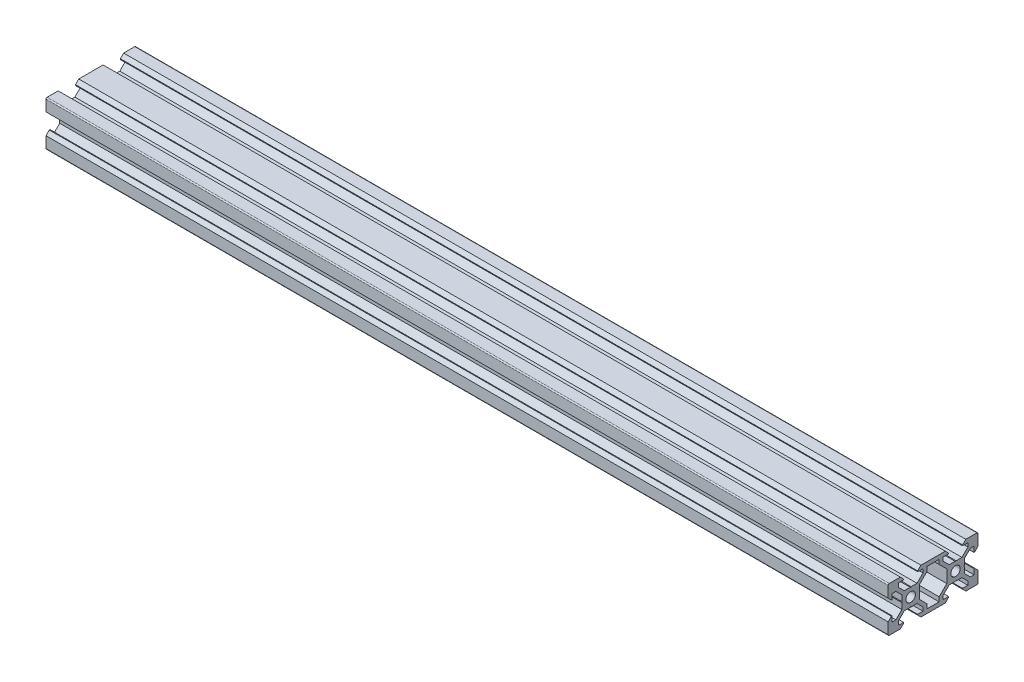
from build123d import *

# Parameters (mm, degrees)
PROFILE_SKETCH_R      = 2.1
PROFILE_EXTRUDE_DEPTH = 375


with BuildPart() as part:
    # Profile Sketch → Profile Extrude (new body)
    with BuildSketch(Plane(origin=(0, 0, 0), x_dir=(0, 0, -1), z_dir=(1, 0, 0))):
        with BuildLine():
            Line((6.875, 8.545), (5.42, 10))
            Line((5.42, 10), (-5.42, 10))
            Line((-5.42, 10), (-6.875, 8.545))
            Line((-6.875, 8.545), (-6.875, 8.2))
            Line((-6.875, 8.2), (-4.5, 8.2))
            Line((-4.5, 8.2), (-4.5, 6.56))
            Line((-4.5, 6.56), (-7.16, 3.9))
            Line((-7.16, 3.9), (-9.79, 3.9))
            Line((-9.79, 3.9), (-10, 3.69))
            Line((-10, 3.69), (-10.21, 3.9))
            Line((-10.21, 3.9), (-12.84, 3.9))
            Line((-12.84, 3.9), (-15.5, 6.56))
            Line((-15.5, 6.56), (-15.5, 8.2))
            Line((-15.5, 8.2), (-13.125, 8.2))
            Line((-13.125, 8.2), (-13.125, 8.545))
            Line((-13.125, 8.545), (-14.58, 10))
            Line((-14.58, 10), (-19.5, 10))
            ThreePointArc((-19.5, 10), (-19.853553391, 9.853553391), (-20, 9.5))
            Line((-20, 9.5), (-20, 4.58))
            Line((-20, 4.58), (-18.545, 3.125))
            Line((-18.545, 3.125), (-18.2, 3.125))
            Line((-18.2, 3.125), (-18.2, 5.5))
            Line((-18.2, 5.5), (-16.56, 5.5))
            Line((-16.56, 5.5), (-13.9, 2.838679656))
            Line((-13.9, 2.838679656), (-13.9, 0.21))
            Line((-13.9, 0.21), (-13.69, 0))
            Line((-13.69, 0), (-13.9, -0.21))
            Line((-13.9, -0.21), (-13.9, -2.838679656))
            Line((-13.9, -2.838679656), (-16.56, -5.5))
            Line((-16.56, -5.5), (-18.2, -5.5))
            Line((-18.2, -5.5), (-18.2, -3.125))
            Line((-18.2, -3.125), (-18.545, -3.125))
            Line((-18.545, -3.125), (-20, -4.58))
            Line((-20, -4.58), (-20, -9.5))
            ThreePointArc((-20, -9.5), (-19.853553391, -9.853553391), (-19.5, -10))
            Line((-19.5, -10), (-14.58, -10))
            Line((-14.58, -10), (-13.125, -8.545))
            Line((-13.125, -8.545), (-13.125, -8.2))
            Line((-13.125, -8.2), (-15.5, -8.2))
            Line((-15.5, -8.2), (-15.5, -6.56))
            Line((-15.5, -6.56), (-12.84, -3.9))
            Line((-12.84, -3.9), (-10.21, -3.9))
            Line((-10.21, -3.9), (-10, -3.69))
            Line((-10, -3.69), (-9.79, -3.9))
            Line((-9.79, -3.9), (-7.16, -3.9))
            Line((-7.16, -3.9), (-4.5, -6.56))
            Line((-4.5, -6.56), (-4.5, -8.2))
            Line((-4.5, -8.2), (-6.875, -8.2))
            Line((-6.875, -8.2), (-6.875, -8.545))
            Line((-6.875, -8.545), (-5.42, -10))
            Line((-5.42, -10), (5.42, -10))
            Line((5.42, -10), (6.875, -8.545))
            Line((6.875, -8.545), (6.875, -8.2))
            Line((6.875, -8.2), (4.5, -8.2))
            Line((4.5, -8.2), (4.5, -6.56))
            Line((4.5, -6.56), (7.16, -3.9))
            Line((7.16, -3.9), (9.79, -3.9))
            Line((9.79, -3.9), (10, -3.69))
            Line((10, -3.69), (10.21, -3.9))
            Line((10.21, -3.9), (12.84, -3.9))
            Line((12.84, -3.9), (15.5, -6.56))
            Line((15.5, -6.56), (15.5, -8.2))
            Line((15.5, -8.2), (13.125, -8.2))
            Line((13.125, -8.2), (13.125, -8.545))
            Line((13.125, -8.545), (14.58, -10))
            Line((14.58, -10), (19.5, -10))
            ThreePointArc((19.5, -10), (19.853553391, -9.853553391), (20, -9.5))
            Line((20, -9.5), (20, -4.58))
            Line((20, -4.58), (18.545, -3.125))
            Line((18.545, -3.125), (18.2, -3.125))
            Line((18.2, -3.125), (18.2, -5.5))
            Line((18.2, -5.5), (16.56, -5.5))
            Line((16.56, -5.5), (13.9, -2.838679656))
            Line((13.9, -2.838679656), (13.9, -0.21))
            Line((13.9, -0.21), (13.69, 0))
            Line((13.69, 0), (13.9, 0.21))
            Line((13.9, 0.21), (13.9, 2.838679656))
            Line((13.9, 2.838679656), (16.56, 5.5))
            Line((16.56, 5.5), (18.2, 5.5))
            Line((18.2, 5.5), (18.2, 3.125))
            Line((18.2, 3.125), (18.545, 3.125))
            Line((18.545, 3.125), (20, 4.58))
            Line((20, 4.58), (20, 9.5))
            ThreePointArc((20, 9.5), (19.853553391, 9.853553391), (19.5, 10))
            Line((19.5, 10), (14.58, 10))
            Line((14.58, 10), (13.125, 8.545))
            Line((13.125, 8.545), (13.125, 8.2))
            Line((13.125, 8.2), (15.5, 8.2))
            Line((15.5, 8.2), (15.5, 6.56))
            Line((15.5, 6.56), (12.84, 3.9))
            Line((12.84, 3.9), (10.21, 3.9))
            Line((10.21, 3.9), (10, 3.69))
            Line((10, 3.69), (9.79, 3.9))
            Line((9.79, 3.9), (7.16, 3.9))
            Line((7.16, 3.9), (4.5, 6.56))
            Line((4.5, 6.56), (4.5, 8.2))
            Line((4.5, 8.2), (6.875, 8.2))
            Line((6.875, 8.2), (6.875, 8.545))
        make_face()
        with Locations((-10, 0)):
            Circle(PROFILE_SKETCH_R, mode=Mode.SUBTRACT)
        with Locations((10, 0)):
            Circle(PROFILE_SKETCH_R, mode=Mode.SUBTRACT)
        Polygon((-2.7, 8.2), (2.7, 8.2), (2.7, 6.238679656), (6.1, 2.838679656), (6.1, -0.21), (6.1, -2.838679656), (2.7, -6.238679656), (2.7, -8.2), (-2.7, -8.2), (-2.7, -6.238679656), (-6.1, -2.838679656), (-6.1, -0.21), (-6.1, 2.838679656), (-2.7, 6.238679656), align=None, mode=Mode.SUBTRACT)
    extrude(amount=PROFILE_EXTRUDE_DEPTH)


solid = part.part
